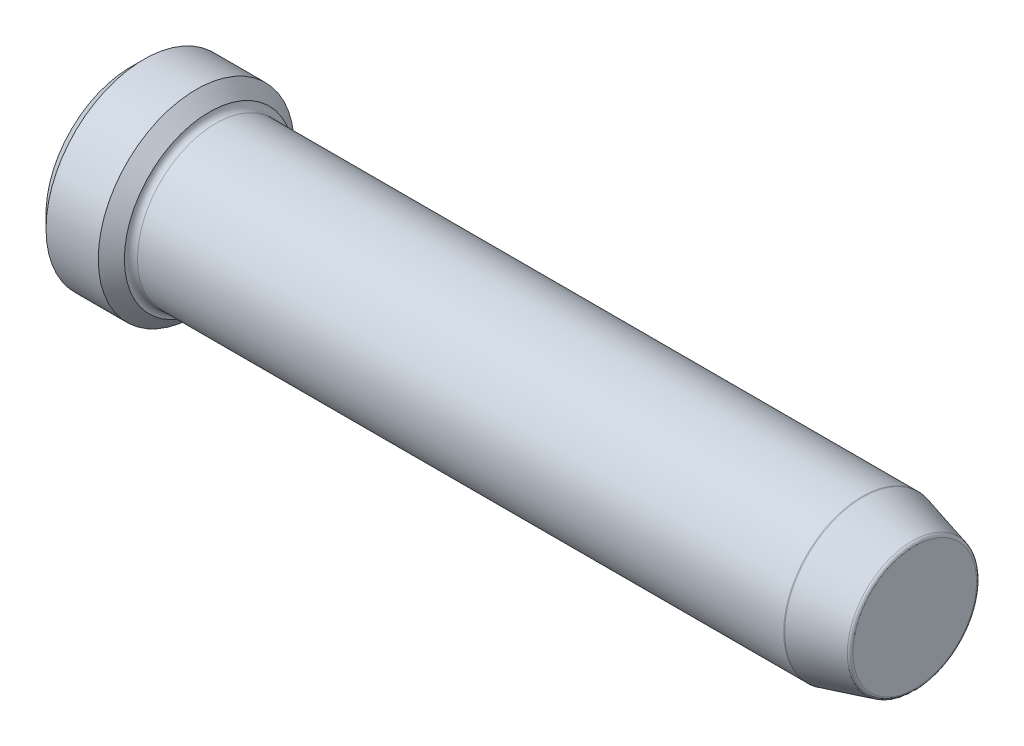
from build123d import *

# Parameters (mm, degrees)
CHAMFER_1_SIZE = 1
FILLET_1_R     = 0.5
FILLET_2_R     = 0.25


with BuildPart() as part:
    # 草图2 → 旋转1 (revolve)
    with BuildSketch(Plane.XY, mode=Mode.PRIVATE) as revolve_1_sk:
        Polygon((0, 0), (0, 7.5), (6, 7.5), (6, 6), (56, 6), (60, 4.92820323), (60, 0), align=None)
    revolve(revolve_1_sk.sketch.rotate(Axis((-70.654432031, 0, 0), (1, 0, 0)), 90), axis=Axis((-70.654432031, 0, 0), (1, 0, 0)))

    # 倒角1
    chamfer_1_edges = [part.edges().sort_by_distance(p)[0] for p in [
        (6, 0, -7.5),
        (0, 0, -7.5),
    ]]
    chamfer(chamfer_1_edges, length=CHAMFER_1_SIZE)

    # 圆角1
    fillet_1_edges = [part.edges().sort_by_distance(p)[0] for p in [
        (6, 0, -6),
    ]]
    fillet(fillet_1_edges, radius=FILLET_1_R - 0.0001)  # a hair under: the kernel refuses the full size

    # 圆角2
    fillet_2_edges = [part.edges().sort_by_distance(p)[0] for p in [
        (60, 0, -4.92820323),
        (56, 0, -6),
    ]]
    fillet(fillet_2_edges, radius=FILLET_2_R)


solid = part.part
